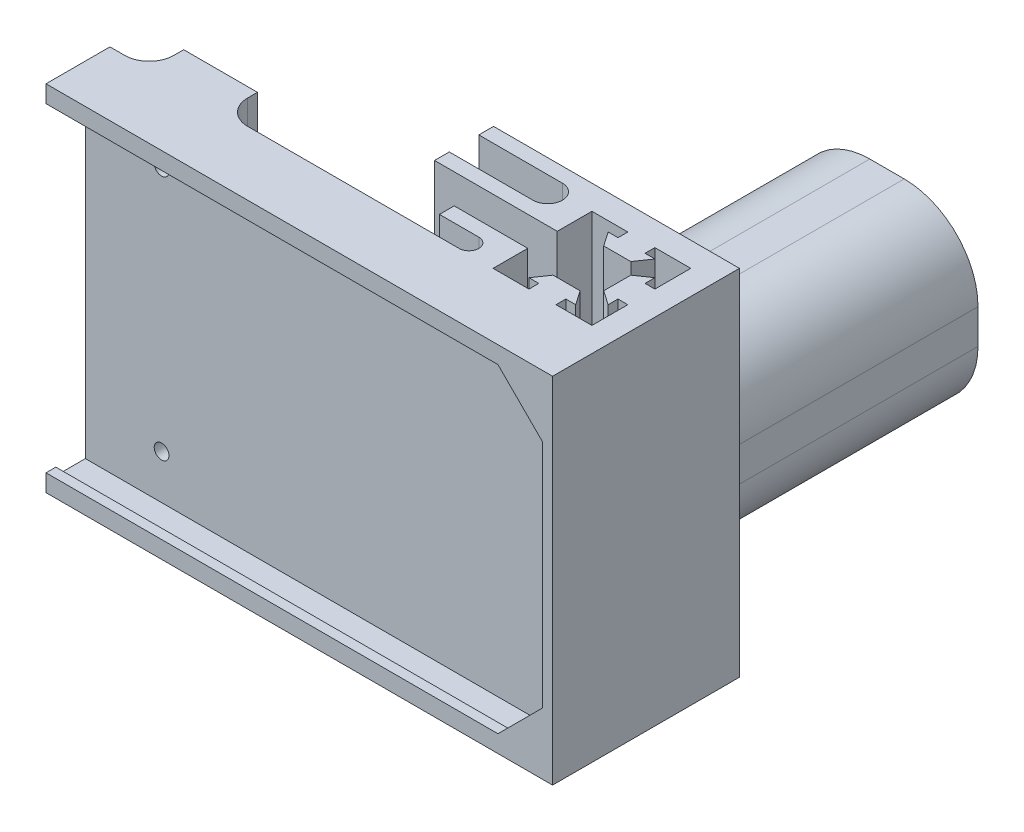
from build123d import *

# Parameters (mm, degrees)
SKETCH5_W            = 30
SKETCH5_H            = 30
BOSS_EXTRUDE3_DEPTH  = 72
CUT_EXTRUDE1_DEPTH   = 84.570329663
SKETCH8_W            = 4.95
SKETCH8_H            = 6
CUT_EXTRUDE3_DEPTH   = 84.570329663
SKETCH10_W           = 3
SKETCH10_H           = 72
BOSS_EXTRUDE4_DEPTH  = 10
SKETCH11_W           = 37
SKETCH11_H           = 37
BOSS_EXTRUDE5_DEPTH  = 50
SKETCH14_R           = 1.5
CUT_EXTRUDE4_DEPTH   = 20
FILLET2_R            = 15
SKETCH16_W           = 5
SKETCH16_H           = 72
BOSS_EXTRUDE6_DEPTH  = 73
BOSS_EXTRUDE7_DEPTH  = 8
SKETCH20_W           = 103
SKETCH20_H           = 2
BOSS_EXTRUDE8_DEPTH  = 1.5
SKETCH21_W           = 103
SKETCH21_H           = 2
BOSS_EXTRUDE9_DEPTH  = 1.5
SKETCH22_W           = 15
SKETCH22_H           = 7
BOSS_EXTRUDE10_DEPTH = 72
FILLET4_R            = 5
FILLET5_R            = 3
FILLET6_R            = 2
SKETCH23_R           = 1.5
CUT_EXTRUDE5_DEPTH   = 124.032516027
SKETCH24_W           = 3
SKETCH24_H           = 72
BOSS_EXTRUDE11_DEPTH = 10


with BuildPart() as part:
    # Sketch5 → Boss-Extrude3 (new body)
    with BuildSketch(Plane(origin=(0, 0, 0), x_dir=(1, 0, 0), z_dir=(0, 1, 0))):
        with Locations((15, -15)):
            Rectangle(SKETCH5_W, SKETCH5_H)
    extrude(amount=BOSS_EXTRUDE3_DEPTH)

    # Sketch6 → Cut-Extrude1 (cut, through all)
    with BuildSketch(Plane(origin=(0, 72, 0), x_dir=(1, 0, 0), z_dir=(0, 1, 0))):
        Polygon((12.25, -4.95), (4.95, -4.95), (4.95, -15), (20.15, -15), (20.15, -12.25), (23.05, -10.25), (23.05, -12.25), (25.05, -12.25), (25.05, -4.95), (17.75, -4.95), (17.75, -6.95), (19.75, -6.95), (17.75, -9.85), (12.25, -9.85), (10.25, -6.95), (12.25, -6.95), align=None)
        Polygon((20.15, -15), (4.95, -15), (4.95, -25.05), (12.25, -25.05), (12.25, -23.05), (10.25, -23.05), (12.25, -20.15), (17.75, -20.15), (19.75, -23.05), (17.75, -23.05), (17.75, -25.05), (25.05, -25.05), (25.05, -17.75), (23.05, -17.75), (23.05, -19.75), (20.15, -17.75), align=None)
    extrude(amount=-CUT_EXTRUDE1_DEPTH, mode=Mode.SUBTRACT)

    # Sketch8 → Cut-Extrude3 (cut, through all)
    with BuildSketch(Plane(origin=(0, 72, 0), x_dir=(1, 0, 0), z_dir=(0, 1, 0))):
        with Locations((2.475, -15)):
            Rectangle(SKETCH8_W, SKETCH8_H)
    extrude(amount=-CUT_EXTRUDE3_DEPTH, mode=Mode.SUBTRACT)

    # Sketch10 → Boss-Extrude4 (add)
    with BuildSketch(Plane.ZY):
        with Locations((1.5, 36)):
            Rectangle(SKETCH10_W, SKETCH10_H)
        with Locations((10.5, 36)):
            Rectangle(SKETCH10_W, SKETCH10_H)
        with Locations((19.5, 36)):
            Rectangle(SKETCH10_W, SKETCH10_H)
    extrude(amount=BOSS_EXTRUDE4_DEPTH)

    # Sketch11 → Boss-Extrude5 (add)
    with BuildSketch(Plane(origin=(0, 0, 0), x_dir=(-1, 0, 0), z_dir=(0, 0, -1))):
        with Locations((-10, 36)):
            Rectangle(SKETCH11_W, SKETCH11_H)
    extrude(amount=BOSS_EXTRUDE5_DEPTH)

    # Sketch14 → Cut-Extrude4 (cut)
    with BuildSketch(Plane(origin=(0, 0, -50), x_dir=(-1, 0, 0), z_dir=(0, 0, -1))):
        with Locations((-10, 49.5)):
            Circle(SKETCH14_R)
        with Locations((1.691342951, 29.25)):
            Circle(SKETCH14_R)
        with Locations((-21.691342951, 29.25)):
            Circle(SKETCH14_R)
    extrude(amount=-CUT_EXTRUDE4_DEPTH, mode=Mode.SUBTRACT)

    # Fillet2
    fillet2_edges = [part.edges().sort_by_distance(p)[0] for p in [
        (28.5, 54.5, -25),
        (28.5, 17.5, -25),
        (-8.5, 17.5, -25),
        (-8.5, 54.5, -25),
    ]]
    fillet(fillet2_edges, radius=FILLET2_R)

    # Sketch16 → Boss-Extrude6 (add)
    with BuildSketch(Plane.ZY):
        with Locations((27.5, 36)):
            Rectangle(SKETCH16_W, SKETCH16_H)
    extrude(amount=BOSS_EXTRUDE6_DEPTH)

    # Sketch19 → Boss-Extrude7 (add)
    with BuildSketch(Plane.XY.offset(30)):
        Polygon((-73, 72), (-73, 70), (17.393398282, 70), (28, 59.393398282), (28, 12.606601718), (17.393398282, 2), (-73, 2), (-73, 0), (30, 0), (30, 72), align=None)
    extrude(amount=BOSS_EXTRUDE7_DEPTH)

    # Sketch20 → Boss-Extrude8 (add)
    with BuildSketch(Plane.XZ.offset(-70)):
        with Locations((-21.5, 37)):
            Rectangle(SKETCH20_W, SKETCH20_H)
    extrude(amount=BOSS_EXTRUDE8_DEPTH)

    # Sketch21 → Boss-Extrude9 (add)
    with BuildSketch(Plane(origin=(0, 2, 0), x_dir=(1, 0, 0), z_dir=(0, 1, 0))):
        with Locations((-21.5, -37)):
            Rectangle(SKETCH21_W, SKETCH21_H)
    extrude(amount=BOSS_EXTRUDE9_DEPTH)

    # Sketch22 → Boss-Extrude10 (add)
    with BuildSketch(Plane(origin=(0, 72, 0), x_dir=(1, 0, 0), z_dir=(0, 1, 0))):
        with Locations((-57.5, -21.5)):
            Rectangle(SKETCH22_W, SKETCH22_H)
    extrude(amount=-BOSS_EXTRUDE10_DEPTH)

    # Fillet4
    fillet4_edges = [part.edges().sort_by_distance(p)[0] for p in [
        (-65, 36, 25),
        (-50, 36, 25),
    ]]
    fillet(fillet4_edges, radius=FILLET4_R)

    # Fillet5
    fillet5_edges = [part.edges().sort_by_distance(p)[0] for p in [
        (0, 36, 3),
        (0, 36, 9),
    ]]
    fillet(fillet5_edges, radius=FILLET5_R - 0.0001)  # a hair under: the kernel refuses the full size

    # Fillet6
    fillet6_edges = [part.edges().sort_by_distance(p)[0] for p in [
        (0, 36, 21),
        (0, 36, 25),
    ]]
    fillet(fillet6_edges, radius=FILLET6_R - 0.0001)  # a hair under: the kernel refuses the full size

    # Sketch23 → Cut-Extrude5 (cut, through all)
    with BuildSketch(Plane(origin=(0, 0, 18), x_dir=(-1, 0, 0), z_dir=(0, 0, -1))):
        with Locations((57.5, 61)):
            Circle(SKETCH23_R)
        with Locations((57.5, 11)):
            Circle(SKETCH23_R)
    extrude(amount=-CUT_EXTRUDE5_DEPTH, mode=Mode.SUBTRACT)

    # Sketch24 → Boss-Extrude11 (add)
    with BuildSketch(Plane.ZY.offset(10)):
        with Locations((1.5, 36)):
            Rectangle(SKETCH24_W, SKETCH24_H)
        with Locations((10.5, 36)):
            Rectangle(SKETCH24_W, SKETCH24_H)
    extrude(amount=BOSS_EXTRUDE11_DEPTH)


solid = part.part
